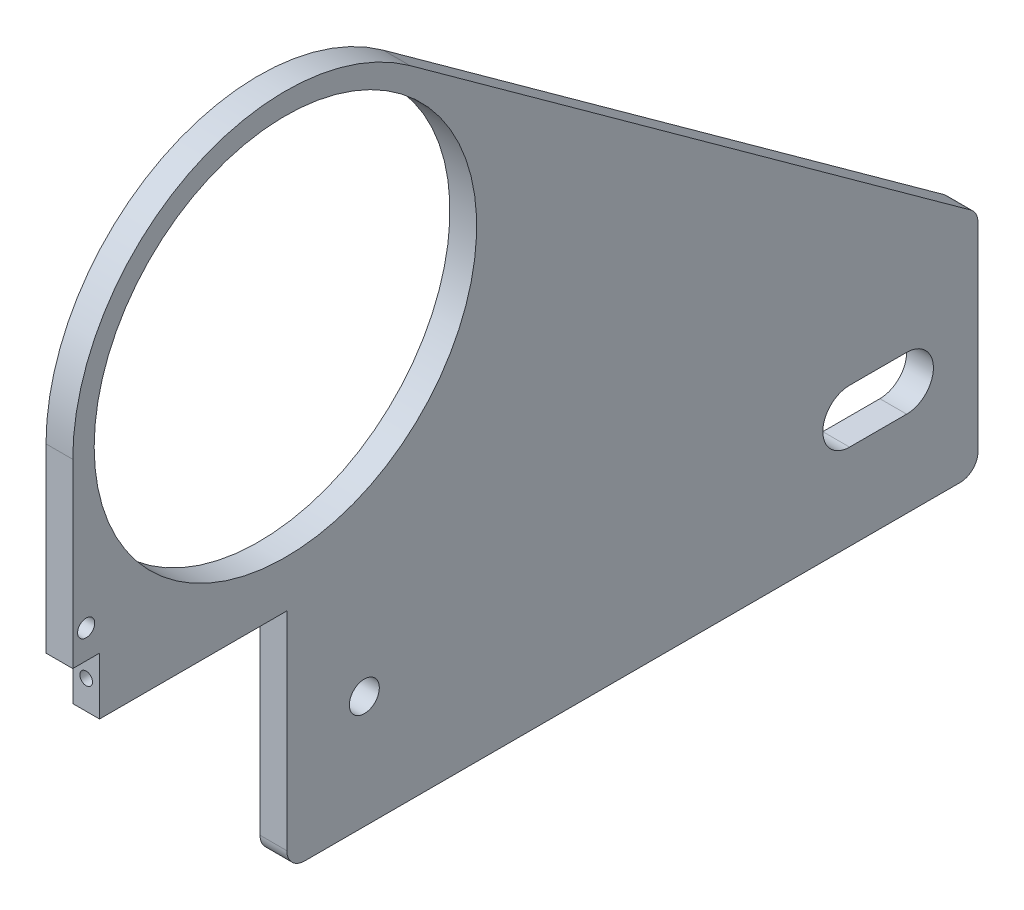
from build123d import *

# Parameters (mm, degrees)
SKETCH1_R           = 1.524
SKETCH1_R_2         = 2.667
SKETCH1_R_3         = 34.04
BOSS_EXTRUDE1_DEPTH = 4.7625
SKETCH2_R           = 1.1303
CUT_EXTRUDE1_DEPTH  = 6.35


with BuildPart() as part:
    # Sketch1 → Boss-Extrude1 (new body)
    with BuildSketch(Plane(origin=(0, 0, 0), x_dir=(0, 0, -1), z_dir=(1, 0, 0))):
        with BuildLine():
            Line((-39.282795117, 0), (77.382795117, 0))
            ThreePointArc((77.382795117, 0), (79.627859148, 0.92993597), (80.557795117, 3.175))
            Line((80.557795117, 3.175), (80.557795117, 38.509654789))
            ThreePointArc((80.557795117, 38.509654789), (80.210081315, 39.954326985), (79.243100468, 41.082569284))
            Line((79.243100468, 41.082569284), (-20.530611645, 113.222382255))
            ThreePointArc((-20.530611645, 113.222382255), (-59.930107761, 116.254813413), (-80.557795117, 82.55))
            Line((-80.557795117, 82.55), (-80.557795117, 50.292))
            Line((-80.557795117, 50.292), (-75.795295117, 50.292))
            Line((-75.795295117, 50.292), (-75.795295117, 40.132))
            Line((-75.795295117, 40.132), (-42.457795117, 40.132))
            Line((-42.457795117, 40.132), (-42.457795117, 3.175))
            ThreePointArc((-42.457795117, 3.175), (-41.527859148, 0.92993597), (-39.282795117, 0))
        make_face()
        with Locations((-78.176545117, 55.372)):
            Circle(SKETCH1_R, mode=Mode.SUBTRACT)
        with Locations((-28.662204883, 20.066)):
            Circle(SKETCH1_R_2, mode=Mode.SUBTRACT)
        with Locations((-42.707795117, 82.55)):
            Circle(SKETCH1_R_3, mode=Mode.SUBTRACT)
        with BuildLine():
            Line((67.857795117, 15.3035), (57.697795117, 15.3035))
            ThreePointArc((57.697795117, 15.3035), (52.935295117, 20.066), (57.697795117, 24.8285))
            Line((57.697795117, 24.8285), (67.857795117, 24.8285))
            ThreePointArc((67.857795117, 24.8285), (72.620295117, 20.066), (67.857795117, 15.3035))
        make_face(mode=Mode.SUBTRACT)
    extrude(amount=BOSS_EXTRUDE1_DEPTH)

    # Sketch2 → Cut-Extrude1 (cut)
    with BuildSketch(Plane.XY.offset(75.795295117)):
        with Locations((2.38125, 45.212)):
            Circle(SKETCH2_R)
    extrude(amount=-CUT_EXTRUDE1_DEPTH, mode=Mode.SUBTRACT)


solid = part.part
